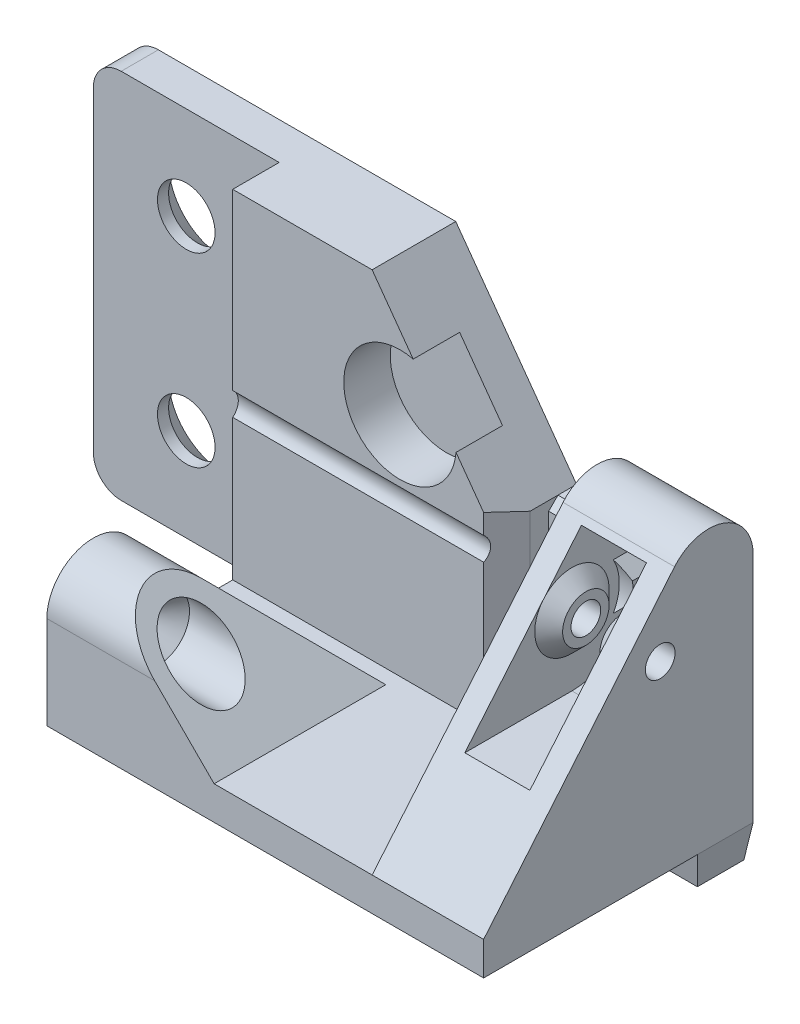
from build123d import *

# Parameters (mm, degrees)
SKETCH1_R               = 3.1
BOSS_EXTRUDE1_DEPTH     = 9
SKETCH2_W               = 20
SKETCH2_H               = 40
CUT_EXTRUDE1_DEPTH      = 5
SKETCH3_R               = 6.05
CUT_EXTRUDE2_DEPTH      = 5
BOSS_EXTRUDE2_DEPTH     = 20
CUT_EXTRUDE4_REACH      = 77.697
SKETCH6_R               = 1.6
CUT_EXTRUDE3_DEPTH      = 3.5
CUT_EXTRUDE3_DEPTH_BACK = 3.5
SKETCH11_W              = 7
SKETCH11_H              = 12
CUT_EXTRUDE9_DEPTH      = 6
CHAMFER3_SIZE           = 6
CHAMFER3_SIZE2          = 4
CHAMFER4_SIZE           = 1
BOSS_EXTRUDE3_START     = 1.5
SKETCH12_R              = 2.5
SKETCH12_R_2            = 1.6
BOSS_EXTRUDE3_DEPTH     = 1.5
SKETCH13_R              = 2.5
SKETCH13_R_2            = 1.6
BOSS_EXTRUDE4_DEPTH     = 1.5
CHAMFER6_SIZE           = 1.5
SKETCH14_W              = 6
SKETCH14_H              = 6
BOSS_EXTRUDE5_DEPTH     = 4
CHAMFER7_SIZE           = 4
CHAMFER7_SIZE_2         = 1
CHAMFER8_SIZE2          = 1
CHAMFER8_SIZE           = 4
CHAMFER9_SIZE           = 2.8
BOSS_EXTRUDE6_DEPTH     = 6
CHAMFER10_START         = 16
CHAMFER10_DEPTH         = 0.6
CHAMFER10_START_2       = 16.6
CHAMFER10_2_DEPTH       = 11.4
CHAMFER10_START_3       = 10
CHAMFER10_3_DEPTH       = 19
CUT_EXTRUDE10_REACH     = 62.216
SKETCH16_R              = 1.55
CUT_EXTRUDE11_REACH     = 69.216
CUT_EXTRUDE11_START     = -7
SKETCH17_R              = 3.35
CHAMFER11_SIZE          = 1.8


with BuildPart() as part:
    # Sketch1 → Boss-Extrude1 (new body)
    with BuildSketch(Plane.XY):
        with BuildLine():
            Line((-10, 17), (-10, -17))
            ThreePointArc((-10, -17), (-9.121320344, -19.121320344), (-7, -20))
            Line((-7, -20), (57, -20))
            Line((57, -20), (57, 20))
            Line((57, 20), (45, 20))
            Line((45, 20), (45, 2))
            Line((45, 2), (38, 2))
            Line((38, 2), (25, 20))
            Line((25, 20), (10, 20))
            Line((10, 20), (-7, 20))
            ThreePointArc((-7, 20), (-9.121320344, 19.121320344), (-10, 17))
        make_face()
        with Locations((0, 10)):
            Circle(SKETCH1_R, mode=Mode.SUBTRACT)
        with Locations((0, -10)):
            Circle(SKETCH1_R, mode=Mode.SUBTRACT)
    extrude(amount=BOSS_EXTRUDE1_DEPTH)

    # Sketch2 → Cut-Extrude1 (cut)
    with BuildSketch(Plane.XY.offset(9)):
        Rectangle(SKETCH2_W, SKETCH2_H)
    extrude(amount=-CUT_EXTRUDE1_DEPTH, mode=Mode.SUBTRACT)

    # Sketch3 → Cut-Extrude2 (cut)
    with BuildSketch(Plane.XY.offset(9)):
        with Locations((28, 8)):
            Circle(SKETCH3_R)
    extrude(amount=-CUT_EXTRUDE2_DEPTH, mode=Mode.SUBTRACT)

    # Sketch4 → Boss-Extrude2 (add)
    with BuildSketch(Plane.XY.offset(9)):
        Polygon((57, -20), (57, 20), (45, 20), (45, -16.4), (10, -16.4), (10, -20), align=None)
    extrude(amount=BOSS_EXTRUDE2_DEPTH)

    # Sketch6 → Cut-Extrude4 (cut, up to next)
    with BuildSketch(Plane(origin=(57, 0, 0), x_dir=(0, 0, -1), z_dir=(1, 0, 0)), mode=Mode.PRIVATE) as cut_extrude4_sk1:
        with Locations(Location((-10, 0, 0), (0, 0, 90))):
            Circle(SKETCH6_R)
    cut_extrude4_tool1 = extrude(cut_extrude4_sk1.sketch, amount=-CUT_EXTRUDE4_REACH, mode=Mode.PRIVATE) & part.part
    # Sketch6 → Cut-Extrude4 (cut, up to next)
    with BuildSketch(Plane(origin=(57, 0, 0), x_dir=(0, 0, -1), z_dir=(1, 0, 0)), mode=Mode.PRIVATE) as cut_extrude4_sk2:
        with BuildLine():
            Line((-8.452703128, 8.053653381), (-29, -16.4))
            Line((-29, -16.4), (-29, 20))
            Line((-29, 20), (0, 20))
            Line((0, 20), (0, 4.973878308))
            ThreePointArc((0, 4.973878308), (-3.148499311, 9.472022499), (-8.452703128, 8.053653381))
        make_face()
    cut_extrude4_tool2 = extrude(cut_extrude4_sk2.sketch, amount=-CUT_EXTRUDE4_REACH, mode=Mode.PRIVATE) & part.part
    add(cut_extrude4_tool1.solids().sort_by_distance((57, 0, 10))[0], mode=Mode.SUBTRACT)
    add(cut_extrude4_tool2.solids().sort_by_distance((57, 8.078553, 17.874396))[0], mode=Mode.SUBTRACT)

    # Sketch5 → Cut-Extrude3 (cut, two sides: drawn at the far end of the back side and taken through both)
    with BuildSketch(Plane(origin=(51, 0, 0), x_dir=(0, 0, -1), z_dir=(1, 0, 0)).offset(-CUT_EXTRUDE3_DEPTH_BACK)):
        with BuildLine():
            Line((-10, 7.5), (-29, 7.5))
            Line((-29, 7.5), (-29, -7.5))
            Line((-29, -7.5), (-10, -7.5))
            ThreePointArc((-10, -7.5), (-2.5, 0), (-10, 7.5))
        make_face()
    extrude(amount=CUT_EXTRUDE3_DEPTH + CUT_EXTRUDE3_DEPTH_BACK, mode=Mode.SUBTRACT)

    # Sketch11 → Cut-Extrude9 (cut)
    with BuildSketch(Plane.XY.offset(9)):
        with Locations((41.5, -4)):
            Rectangle(SKETCH11_W, SKETCH11_H)
    extrude(amount=-CUT_EXTRUDE9_DEPTH, mode=Mode.SUBTRACT)

    # Chamfer3
    chamfer3_edges = [part.edges().sort_by_distance(p)[0] for p in [
        (41.5, -10, 9),
    ]]
    chamfer3_side = [part.faces().sort_by_distance(p)[0] for p in [
        (25.671541958, -9.242433067, 9),
    ]]
    chamfer(chamfer3_edges, length=CHAMFER3_SIZE, length2=CHAMFER3_SIZE2, reference=chamfer3_side[0])

    # Chamfer4
    chamfer4_edges = [part.edges().sort_by_distance(p)[0] for p in [
        (41.5, 2, 3),
    ]]
    chamfer(chamfer4_edges, length=CHAMFER4_SIZE)

    # Sketch12 → Boss-Extrude3 (add)
    # profile 1 of 2: a face of its own
    with BuildSketch(Plane(origin=(47.5, 0, 0), x_dir=(0, 0, -1), z_dir=(1, 0, 0)).offset(BOSS_EXTRUDE3_START)):
        with Locations(Location((-10, 0, 0), (0, 0, 90))):
            Circle(SKETCH12_R)
        with Locations(Location((-10, 0, 0), (0, 0, 90))):
            Circle(SKETCH12_R_2, mode=Mode.SUBTRACT)
    # profile 2 of 2: a face of its own
    with BuildSketch(Plane(origin=(47.5, 0, 0), x_dir=(0, 0, -1), z_dir=(1, 0, 0)).offset(BOSS_EXTRUDE3_START)):
        with BuildLine():
            Line((-5.554777846, 2.5), (-2.822197066, 2.5))
            ThreePointArc((-2.822197066, 2.5), (-2.399285891, 0), (-2.822197066, -2.5))
            Line((-2.822197066, -2.5), (-5.554777846, -2.5))
            ThreePointArc((-5.554777846, -2.5), (-4.9, 0), (-5.554777846, 2.5))
        make_face()
    extrude(amount=-BOSS_EXTRUDE3_DEPTH)

    # Sketch13 → Boss-Extrude4 (add)
    # profile 1 of 2: a face of its own
    with BuildSketch(Plane.ZY.offset(-54.5)):
        with Locations(Location((10, 0, 0), (0, 0, 90))):
            Circle(SKETCH13_R)
        with Locations(Location((10, 0, 0), (0, 0, 90))):
            Circle(SKETCH13_R_2, mode=Mode.SUBTRACT)
    # profile 2 of 2: a face of its own
    with BuildSketch(Plane.ZY.offset(-54.5)):
        with BuildLine():
            Line((5.554777846, 2.5), (2.928932188, 2.5))
            ThreePointArc((2.928932188, 2.5), (2.5, 0), (2.928932188, -2.5))
            Line((2.928932188, -2.5), (5.554777846, -2.5))
            ThreePointArc((5.554777846, -2.5), (4.9, 0), (5.554777846, 2.5))
        make_face()
    extrude(amount=BOSS_EXTRUDE4_DEPTH)

    # Chamfer6
    # the kernel refuses this chamfer: 1.5 mm, written as the material it adds along each edge
    with BuildSketch(Plane(origin=(54.5, 0, 10), x_dir=(0, 1, 0), z_dir=(0, 0, 1))) as chamfer6_piece_1_section:
        Polygon((2.5 + CHAMFER6_SIZE, 0), (2.5, CHAMFER6_SIZE), (2.5, 0), align=None)
    chamfer6_piece_1 = revolve(axis=Axis((54.5, 0, 10), (-1, 0, 0)), mode=Mode.PRIVATE)
    chamfer6_piece_1 = split(chamfer6_piece_1, bisect_by=Plane(origin=(54.5, 2.570872815, 13.059635197), z_dir=(0, -0.6433064031075088, -0.7656088242182685)), keep=Keep.TOP, mode=Mode.PRIVATE)
    add(chamfer6_piece_1)
    with BuildSketch(Plane(origin=(47.5, 0, 10), x_dir=(0, 1, 0), z_dir=(0, 0, -1))) as chamfer6_piece_2_section:
        Polygon((2.5 + CHAMFER6_SIZE, 0), (2.5, CHAMFER6_SIZE), (2.5, 0), align=None)
    chamfer6_piece_2 = revolve(axis=Axis((47.5, 0, 10), (1, 0, 0)), mode=Mode.PRIVATE)
    chamfer6_piece_2 = split(chamfer6_piece_2, bisect_by=Plane(origin=(47.5, 2.570872815, 13.059635197), z_dir=(0, -0.6433064031075088, -0.7656088242182685)), keep=Keep.TOP, mode=Mode.PRIVATE)
    add(chamfer6_piece_2)
    # the kernel refuses this chamfer: 1.5 mm, written as the material it takes off along each edge
    with BuildSketch(Plane(origin=(49, -2.5, -0.928592294), x_dir=(-1, 0, 0), z_dir=(0, 0, 1))) as chamfer6_2_piece_1_section:
        Polygon((CHAMFER6_SIZE, 0), (0, -CHAMFER6_SIZE), (0, 0), align=None)
    chamfer6_2_piece_1 = extrude(amount=10.340894622, mode=Mode.PRIVATE)
    chamfer6_2_piece_1 = chamfer6_2_piece_1 & Plane(origin=(49, 0, 10), x_dir=(0, -1, 0), z_dir=(-1, 0, 0)) * Cylinder(7.5, 27, mode=Mode.PRIVATE)
    chamfer6_2_piece_1 = chamfer6_2_piece_1 - Plane(origin=(49, 0, 10), x_dir=(0, -0.49019607843137236, -0.8716121870938381), z_dir=(1, 0, 0)) * Cylinder(5.1, 27, mode=Mode.PRIVATE)
    add(chamfer6_2_piece_1, mode=Mode.SUBTRACT)
    with BuildSketch(Plane(origin=(49, 2.5, 9.412302328), x_dir=(0, -1, 0), z_dir=(0, 0, -1))) as chamfer6_2_piece_2_section:
        Polygon((CHAMFER6_SIZE, 0), (0, CHAMFER6_SIZE), (0, 0), align=None)
    chamfer6_2_piece_2 = extrude(amount=10.340894622, mode=Mode.PRIVATE)
    chamfer6_2_piece_2 = chamfer6_2_piece_2 & Plane(origin=(49, 0, 10), x_dir=(0, -1, 0), z_dir=(-1, 0, 0)) * Cylinder(7.5, 27, mode=Mode.PRIVATE)
    chamfer6_2_piece_2 = chamfer6_2_piece_2 - Plane(origin=(49, 0, 10), x_dir=(0, -0.49019607843137236, -0.8716121870938381), z_dir=(1, 0, 0)) * Cylinder(5.1, 27, mode=Mode.PRIVATE)
    add(chamfer6_2_piece_2, mode=Mode.SUBTRACT)
    with BuildSketch(Plane(origin=(53, -2.5, -0.928592294), x_dir=(1, 0, 0), z_dir=(0, 0, 1))) as chamfer6_2_piece_3_section:
        Polygon((CHAMFER6_SIZE, 0), (0, CHAMFER6_SIZE), (0, 0), align=None)
    chamfer6_2_piece_3 = extrude(amount=10.340894622, mode=Mode.PRIVATE)
    chamfer6_2_piece_3 = chamfer6_2_piece_3 & Plane(origin=(53, 0, 10), x_dir=(0, -1, 0), z_dir=(-1, 0, 0)) * Cylinder(7.5, 27, mode=Mode.PRIVATE)
    chamfer6_2_piece_3 = chamfer6_2_piece_3 - Plane(origin=(53, 0, 10), x_dir=(0, -0.4901960784313735, -0.8716121870938375), z_dir=(1, 0, 0)) * Cylinder(5.1, 27, mode=Mode.PRIVATE)
    add(chamfer6_2_piece_3, mode=Mode.SUBTRACT)
    with BuildSketch(Plane(origin=(53, 2.5, 9.412302328), x_dir=(1, 0, 0), z_dir=(0, 0, -1))) as chamfer6_2_piece_4_section:
        Polygon((CHAMFER6_SIZE, 0), (0, CHAMFER6_SIZE), (0, 0), align=None)
    chamfer6_2_piece_4 = extrude(amount=10.340894622, mode=Mode.PRIVATE)
    chamfer6_2_piece_4 = chamfer6_2_piece_4 & Plane(origin=(53, 0, 10), x_dir=(0, -1, 0), z_dir=(-1, 0, 0)) * Cylinder(7.5, 27, mode=Mode.PRIVATE)
    chamfer6_2_piece_4 = chamfer6_2_piece_4 - Plane(origin=(53, 0, 10), x_dir=(0, -0.4901960784313735, -0.8716121870938375), z_dir=(1, 0, 0)) * Cylinder(5.1, 27, mode=Mode.PRIVATE)
    add(chamfer6_2_piece_4, mode=Mode.SUBTRACT)

    # Sketch14 → Boss-Extrude5 (add)
    with BuildSketch(Plane.XZ.offset(20)):
        with Locations((54, 3)):
            Rectangle(SKETCH14_W, SKETCH14_H)
    extrude(amount=BOSS_EXTRUDE5_DEPTH)

    # Chamfer7
    # the kernel refuses this chamfer: 4, 1 mm, written as the material it takes off along each edge
    with BuildSketch(Plane(origin=(40.611490001, -24, 6), x_dir=(0, 1, 0), z_dir=(1, 0, 0)), Plane(origin=(51, -24, -10.388509999), x_dir=(0, 1, 0), z_dir=(0, 0, 1)), Plane(origin=(57, -24, 16.388509999), x_dir=(0, 1, 0), z_dir=(0, 0, -1))) as chamfer7_piece_1:
        Polygon((CHAMFER7_SIZE, 0), (0, -CHAMFER7_SIZE_2), (0, 0), align=None)
    extrude(amount=26.777019998, mode=Mode.SUBTRACT)

    # Chamfer8
    chamfer8_edges = [part.edges().sort_by_distance(p)[0] for p in [
        (38, -8.6244998, 9),
    ]]
    chamfer8_side = [part.faces().sort_by_distance(p)[0] for p in [
        (38, -8.6244998, 8.98),
    ]]
    chamfer(chamfer8_edges, length=CHAMFER8_SIZE - 0.0001, length2=CHAMFER8_SIZE2 - 0.0001, reference=chamfer8_side[0])  # a hair under: the kernel refuses the full size

    # Chamfer9
    chamfer9_edges = [part.edges().sort_by_distance(p)[0] for p in [
        (-3.1, 10, 0),
        (-3.1, -10, 0),
    ]]
    chamfer(chamfer9_edges, length=CHAMFER9_SIZE)

    # Sketch15 → Boss-Extrude6 (add)
    with BuildSketch(Plane.ZY.offset(-10)):
        with BuildLine():
            Line((29, -10), (29, -16.4))
            Line((29, -16.4), (10.528932188, -16.4))
            Line((10.528932188, -16.4), (20.464466094, -6.464466094))
            ThreePointArc((20.464466094, -6.464466094), (25.913417162, -5.380602337), (29, -10))
        make_face()
    extrude(amount=-BOSS_EXTRUDE6_DEPTH)

    # Chamfer10: read off the stored shape, not the designer's step
    # Chamfer10 outline → Chamfer10 (add)
    with BuildSketch(Plane.YZ.offset(CHAMFER10_START)):
        with BuildLine():
            ThreePointArc((-6.464466094, 20.464466094), (-5.380602337, 25.913417162), (-10, 29))
            Line((-10, 29), (-16.4, 29))
            Line((-16.4, 29), (-16.4, 10.528932188))
            Line((-16.4, 10.528932188), (-6.464466094, 20.464466094))
        make_face()
    extrude(amount=CHAMFER10_DEPTH)

    # Chamfer10 2 outline → Chamfer10 2 (add)
    with BuildSketch(Plane.YZ.offset(CHAMFER10_START_2)):
        with BuildLine():
            ThreePointArc((-6.464466094, 20.464466094), (-5.380602337, 25.913417162), (-10, 29))
            Line((-10, 29), (-16.4, 29))
            Line((-16.4, 29), (-16.4, 10.528932188))
            Line((-16.4, 10.528932188), (-6.464466094, 20.464466094))
        make_face()
    extrude(amount=CHAMFER10_2_DEPTH)

    # Chamfer10 3 outline → Chamfer10 3 (cut)
    with BuildSketch(Plane.XY.offset(CHAMFER10_START_3)):
        Polygon((15, -3.4), (28, -16.4), (28, -3), (15, -3), align=None)
    extrude(amount=CHAMFER10_3_DEPTH, mode=Mode.SUBTRACT)

    # Cut-Extrude10: up to this plane
    cut_extrude10_end = Plane(origin=(28, -16.4, 29), z_dir=(0.7071067811865438, 0.7071067811865513, 0))
    # Sketch16 → Cut-Extrude10 (cut, up to the surface)
    with BuildSketch(Plane.ZY.offset(-10), mode=Mode.PRIVATE) as cut_extrude10_sk1:
        with Locations(Location((24, -10, 0), (0, 0, 270))):
            Circle(SKETCH16_R)
    cut_extrude10_tool1 = split(extrude(cut_extrude10_sk1.sketch, amount=-CUT_EXTRUDE10_REACH, mode=Mode.PRIVATE), bisect_by=cut_extrude10_end, keep=Keep.BOTH, mode=Mode.PRIVATE)
    add(cut_extrude10_tool1.solids().sort_by_distance((10, -10, 24))[0], mode=Mode.SUBTRACT)

    # Cut-Extrude11: up to this plane
    cut_extrude11_end = Plane(origin=(28, -16.4, 29), z_dir=(0.7071067811865438, 0.7071067811865513, 0))
    # Sketch17 → Cut-Extrude11 (cut, up to the surface)
    with BuildSketch(Plane.ZY.offset(-10).offset(CUT_EXTRUDE11_START), mode=Mode.PRIVATE) as cut_extrude11_sk1:
        with Locations(Location((24, -10, 0), (0, 0, 270))):
            Circle(SKETCH17_R)
    cut_extrude11_tool1 = split(extrude(cut_extrude11_sk1.sketch, amount=-CUT_EXTRUDE11_REACH, mode=Mode.PRIVATE), bisect_by=cut_extrude11_end, keep=Keep.BOTH, mode=Mode.PRIVATE)
    add(cut_extrude11_tool1.solids().sort_by_distance((17, -10, 24))[0], mode=Mode.SUBTRACT)

    # Chamfer11
    chamfer11_edges = [part.edges().sort_by_distance(p)[0] for p in [
        (17, -8.45, 24),
    ]]
    chamfer(chamfer11_edges, length=CHAMFER11_SIZE - 0.0001)  # a hair under: the kernel refuses the full size


solid = part.part
